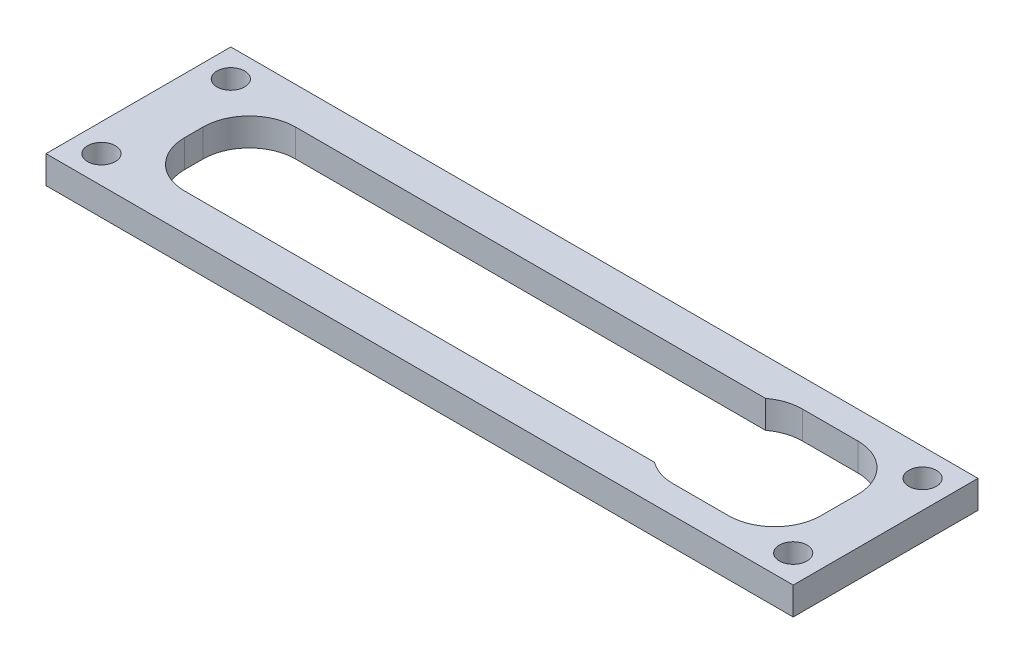
from build123d import *

# Parameters (mm, degrees)
SKETCH1_W           = 80.863890266
SKETCH1_H           = 20
SKETCH1_R           = 1.5
SKETCH1_W_2         = 68.863890266
SKETCH1_H_2         = 12
BOSS_EXTRUDE1_DEPTH = 3
CUT_EXTRUDE1_DEPTH  = 84.354476478
FILLET1_R           = 5


with BuildPart() as part:
    # Sketch1 → Boss-Extrude1 (new body)
    with BuildSketch(Plane(origin=(0, 0, 0), x_dir=(1, 0, 0), z_dir=(0, 1, 0))):
        with Locations((40.431945133, 10)):
            Rectangle(SKETCH1_W, SKETCH1_H)
        with Locations(Location((3, 17, 0), (0, 0, 270))):
            Circle(SKETCH1_R, mode=Mode.SUBTRACT)
        with Locations(Location((3, 3, 0), (0, 0, 90))):
            Circle(SKETCH1_R, mode=Mode.SUBTRACT)
        with Locations(Location((77.863890266, 3, 0), (0, 0, 270))):
            Circle(SKETCH1_R, mode=Mode.SUBTRACT)
        with Locations(Location((77.863890266, 17, 0), (0, 0, 90))):
            Circle(SKETCH1_R, mode=Mode.SUBTRACT)
        with Locations((40.431945133, 10)):
            Rectangle(SKETCH1_W_2, SKETCH1_H_2, mode=Mode.SUBTRACT)
    extrude(amount=BOSS_EXTRUDE1_DEPTH)

    # Sketch2 → Cut-Extrude1 (cut, through all)
    with BuildSketch(Plane(origin=(0, 3, 0), x_dir=(1, 0, 0), z_dir=(0, 1, 0))):
        Polygon((61.863890266, 17), (61.863890266, 16), (74.863890266, 16), (74.863890266, 4), (61.863890266, 4), (61.863890266, 3), (75.863890266, 3), (75.863890266, 17), align=None)
    extrude(amount=-CUT_EXTRUDE1_DEPTH, mode=Mode.SUBTRACT)

    # Fillet1
    # the kernel refuses this fillet: 5 mm, written as the material it adds along each edge
    with BuildSketch(Plane(origin=(75.863890266, 3, -17), x_dir=(0, 0, 1), z_dir=(0, -1, 0)), Plane(origin=(75.863890266, 3, -3), x_dir=(-1, 0, 0), z_dir=(0, -1, 0)), Plane(origin=(6, 0, -16), x_dir=(0, 0, 1), z_dir=(0, 1, 0))) as fillet1_piece_1:
        with BuildLine():
            CenterArc((FILLET1_R, FILLET1_R), FILLET1_R, 180, 90)
            Line((0, FILLET1_R), (-FILLET1_R * 0.02, FILLET1_R))
            Line((-FILLET1_R * 0.02, FILLET1_R), (-FILLET1_R * 0.02, -FILLET1_R * 0.02))
            Line((-FILLET1_R * 0.02, -FILLET1_R * 0.02), (FILLET1_R, -FILLET1_R * 0.02))
            Line((FILLET1_R, -FILLET1_R * 0.02), (FILLET1_R, 0))
        make_face()
    extrude(amount=3)
    with BuildSketch(Plane(origin=(61.863890266, 3, -17), x_dir=(1, 0, 0), z_dir=(0, -1, 0))) as fillet1_piece_2:
        with BuildLine():
            CenterArc((3, 5), FILLET1_R, 233.130102354, 36.869897646)
            Line((0, 1), (-0.06, 0.92))
            ThreePointArc((-0.06, 0.92), (-0.1, 0.5), (-0.1, 0))
            Line((-0.1, 0), (0, -0.1))
            Line((0, -0.1), (3, -0.1))
            Line((3, -0.1), (3, 0))
        make_face()
    extrude(amount=3)
    with BuildSketch(Plane(origin=(61.863890266, 3, -3), x_dir=(0, 0, -1), z_dir=(0, -1, 0))) as fillet1_piece_3:
        with BuildLine():
            CenterArc((5, 3), FILLET1_R, 180, 36.869897646)
            Line((0, 3), (-0.1, 3))
            Line((-0.1, 3), (-0.1, 0))
            Line((-0.1, 0), (0, -0.1))
            ThreePointArc((0, -0.1), (0.5, -0.1), (0.92, -0.06))
            Line((0.92, -0.06), (1, 0))
        make_face()
    extrude(amount=3)
    with BuildSketch(Plane(origin=(6, 0, -4), x_dir=(0, 0, -1), z_dir=(0, 1, 0))) as fillet1_piece_4:
        with BuildLine():
            CenterArc((FILLET1_R, -FILLET1_R), FILLET1_R, 90, 90)
            Line((0, -FILLET1_R), (-FILLET1_R * 0.02, -FILLET1_R))
            Line((-FILLET1_R * 0.02, -FILLET1_R), (-FILLET1_R * 0.02, FILLET1_R * 0.02))
            Line((-FILLET1_R * 0.02, FILLET1_R * 0.02), (FILLET1_R, FILLET1_R * 0.02))
            Line((FILLET1_R, FILLET1_R * 0.02), (FILLET1_R, 0))
        make_face()
    extrude(amount=3)


solid = part.part
